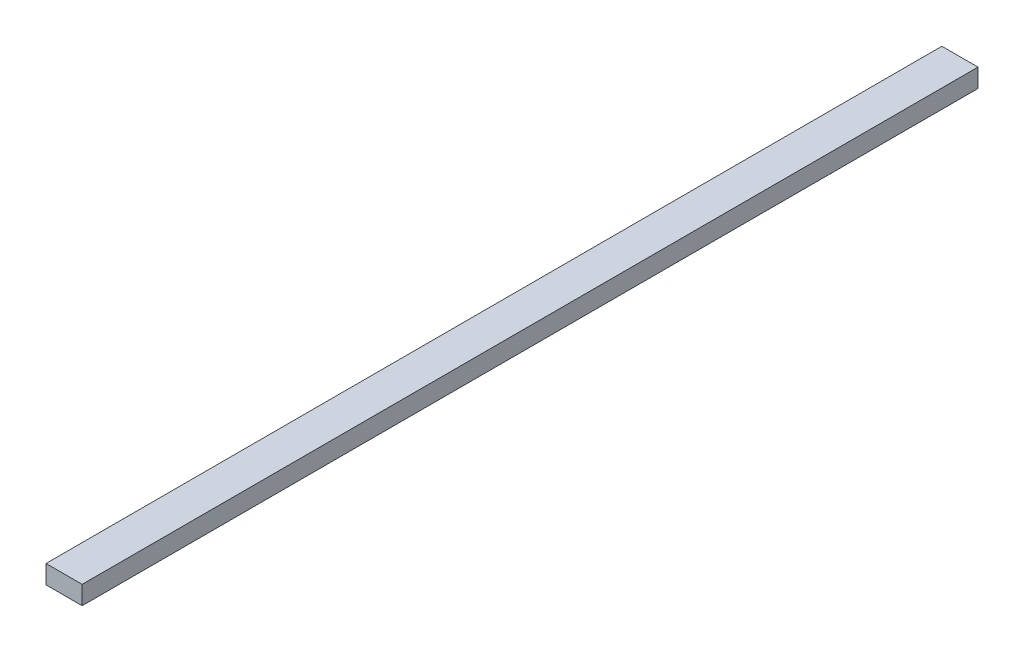
from build123d import *

# Parameters (mm, degrees)
SKETCH1_W           = 38
SKETCH1_H           = 19.5
BOSS_EXTRUDE1_DEPTH = 942


with BuildPart() as part:
    # Sketch1 → Boss-Extrude1 (new body)
    with BuildSketch(Plane.XY):
        with Locations((-7.080898876, 0.350561798)):
            Rectangle(SKETCH1_W, SKETCH1_H)
    extrude(amount=BOSS_EXTRUDE1_DEPTH)


solid = part.part
